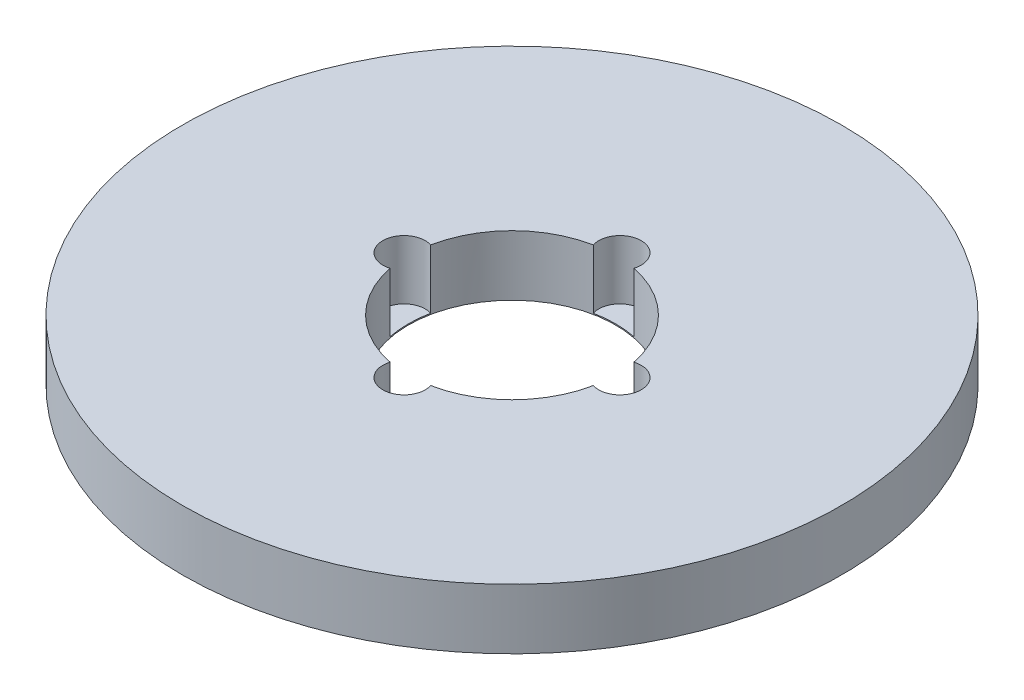
from build123d import *

# Parameters (mm, degrees)
SKETCH1_R           = 87.5
BOSS_EXTRUDE1_DEPTH = 16
SKETCH2_R           = 27.5
CUT_EXTRUDE1_DEPTH  = 125.773795326
SKETCH3_R           = 5.641411182
CUT_EXTRUDE2_DEPTH  = 15.714783971
CIRPATTERN1_COUNT   = 4


with BuildPart() as part:
    # Sketch1 → Boss-Extrude1 (new body)
    with BuildSketch(Plane(origin=(0, 0, 0), x_dir=(1, 0, 0), z_dir=(0, 1, 0))):
        Circle(SKETCH1_R)
    extrude(amount=BOSS_EXTRUDE1_DEPTH)

    # Sketch2 → Cut-Extrude1 (cut, through all)
    with BuildSketch(Plane(origin=(0, 0, 0), x_dir=(1, 0, 0), z_dir=(0, 1, 0))):
        Circle(SKETCH2_R)
    extrude(amount=CUT_EXTRUDE1_DEPTH, mode=Mode.SUBTRACT)

    # Sketch3 → Cut-Extrude2 (cut)
    with BuildSketch(Plane(origin=(0, 16, 0), x_dir=(1, 0, 0), z_dir=(0, 1, 0))):
        with Locations((-28.664400868, 0)):
            Circle(SKETCH3_R)
    cut_extrude2 = extrude(amount=-CUT_EXTRUDE2_DEPTH, mode=Mode.SUBTRACT)

    # CirPattern1: Cut-Extrude2 ×4 about axis
    cirpattern1_axis = Axis((0, 0, 0), (0, 1, 0))
    for i in range(1, CIRPATTERN1_COUNT):
        add(cut_extrude2.rotate(cirpattern1_axis, i * 360 / CIRPATTERN1_COUNT), mode=Mode.SUBTRACT)


solid = part.part
